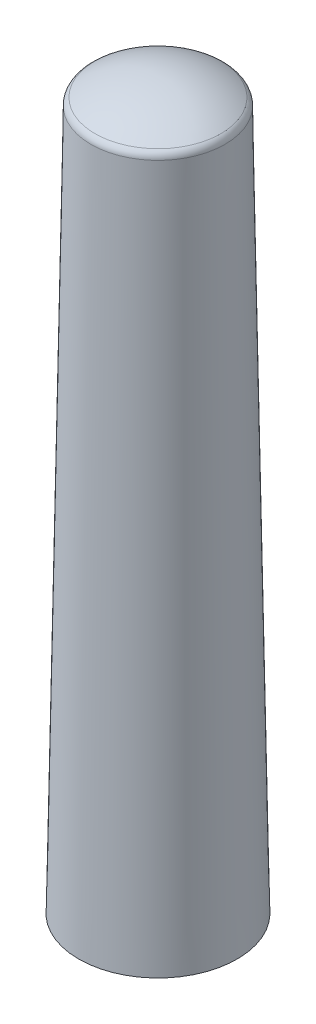
from build123d import *

# Parameters (mm, degrees)
SKETCH1_R           = 4.5
BOSS_EXTRUDE3_DEPTH = 40
SKETCH4_R           = 3.5
CUT_EXTRUDE3_DEPTH  = 0.5
SKETCH5_R           = 3
CUT_EXTRUDE4_DEPTH  = 5
SKETCH6_R           = 2
BOSS_EXTRUDE4_DEPTH = 1
SKETCH7_R           = 0.6
BOSS_EXTRUDE5_DEPTH = 3.5
CHAMFER1_SIZE       = 0.4
CHAMFER1_SIZE2      = 0.145588094
FILLET1_R           = 0.2
CHAMFER2_SIZE       = 40
CHAMFER2_SIZE_2     = 0.698202597
FILLET2_R           = 0.5


# Read off the part's stored shape, not the designer's step: Dome1
with BuildPart() as part:
    # Sketch1 → Boss-Extrude3 (new body)
    with BuildSketch(Plane(origin=(0, 0, 0), x_dir=(1, 0, 0), z_dir=(0, 1, 0))):
        with Locations(Location((0, 0, 0), (0, 0, 270))):
            Circle(SKETCH1_R)
    extrude(amount=BOSS_EXTRUDE3_DEPTH)

    # Sketch4 → Cut-Extrude3 (cut)
    with BuildSketch(Plane.XZ):
        with Locations(Location((0, 0, 0), (0, 0, 270))):
            Circle(SKETCH4_R)
    extrude(amount=-CUT_EXTRUDE3_DEPTH, mode=Mode.SUBTRACT)

    # Sketch5 → Cut-Extrude4 (cut)
    with BuildSketch(Plane.XZ.offset(-0.5)):
        with Locations(Location((0, 0, 0), (0, 0, 270))):
            Circle(SKETCH5_R)
    extrude(amount=-CUT_EXTRUDE4_DEPTH, mode=Mode.SUBTRACT)

    # Sketch6 → Boss-Extrude4 (add)
    with BuildSketch(Plane.XZ.offset(-5.5)):
        with Locations(Location((0, 0, 0), (0, 0, 270))):
            Circle(SKETCH6_R)
    extrude(amount=BOSS_EXTRUDE4_DEPTH)

    # Sketch7 → Boss-Extrude5 (add)
    with BuildSketch(Plane.XZ.offset(-4.5)):
        with Locations(Location((0, 0, 0), (0, 0, 270))):
            Circle(SKETCH7_R)
    extrude(amount=BOSS_EXTRUDE5_DEPTH)

    # Chamfer1
    chamfer1_edges = [part.edges().sort_by_distance(p)[0] for p in [
        (0, 1, 0.6),
    ]]
    chamfer1_side = [part.faces().sort_by_distance(p)[0] for p in [
        (0, 2.75, 0.6),
    ]]
    chamfer(chamfer1_edges, length=CHAMFER1_SIZE, length2=CHAMFER1_SIZE2, reference=chamfer1_side[0])

    # Fillet1
    fillet1_edges = [part.edges().sort_by_distance(p)[0] for p in [
        (0, 1, 0.454411906),
    ]]
    fillet(fillet1_edges, radius=FILLET1_R)

    # Chamfer2
    # the kernel refuses this chamfer: 40, 0.698202597 mm, written as the material it takes off along each edge
    with BuildSketch(Plane(origin=(0, 40, 0), x_dir=(0, 0, 1), z_dir=(-1, 0, 0))) as chamfer2_piece_1:
        Polygon((4.5, -CHAMFER2_SIZE), (4.5 - CHAMFER2_SIZE_2, 0), (4.5, 0), align=None)
    revolve(axis=Axis((0, 40, 0), (0, 1, 0)), mode=Mode.SUBTRACT)

    # Dome1 outline → Dome1 (revolve)
    with BuildSketch(Plane.XY):
        with BuildLine():
            Line((0, 40), (3.801797408, 39.999999996))
            ThreePointArc((3.801797408, 39.999999996), (1.993342892, 40.892878392), (0, 41.2))
            Line((0, 41.2), (0, 40))
        make_face()
    revolve(axis=Axis((0, 0, 0), (0, 1, 0)))

    # Fillet2
    fillet2_edges = [part.edges().sort_by_distance(p)[0] for p in [
        (2.688276724, 40, 2.688276724),
    ]]
    fillet(fillet2_edges, radius=FILLET2_R)


solid = part.part
